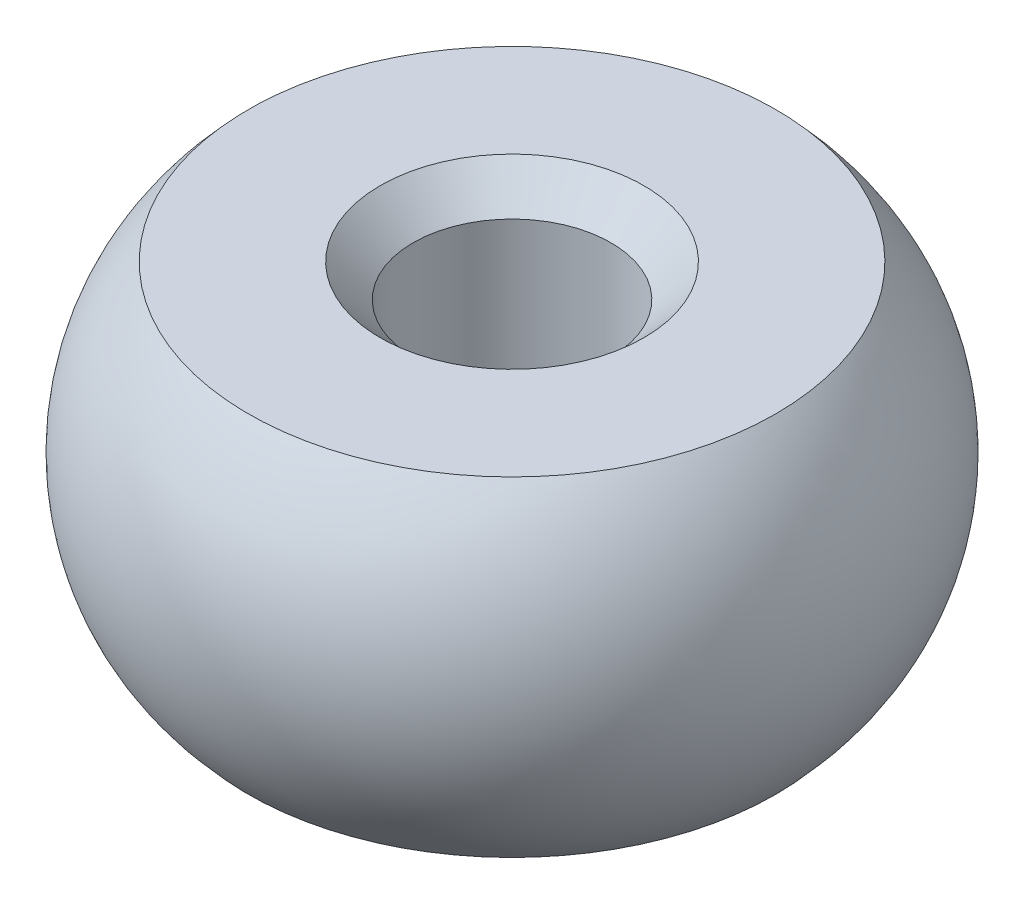
from build123d import *

# Parameters (mm, degrees)
CHAMFER1_SIZE = 0.5


with BuildPart() as part:
    # Sketch1 → Revolve1 (revolve)
    with BuildSketch(Plane.XY):
        with BuildLine():
            Line((1.5, 2.5), (1.5, -2.5))
            Line((1.5, -2.5), (4, -2.5))
            ThreePointArc((4, -2.5), (5, 0), (4, 2.5))
            Line((4, 2.5), (1.5, 2.5))
        make_face()
    revolve(axis=Axis((0, -90.723864171, 0), (0, 1, 0)))

    # Chamfer1
    chamfer1_edges = [part.edges().sort_by_distance(p)[0] for p in [
        (-1.5, 2.5, 0),
        (-1.5, -2.5, 0),
    ]]
    chamfer(chamfer1_edges, length=CHAMFER1_SIZE)


solid = part.part
